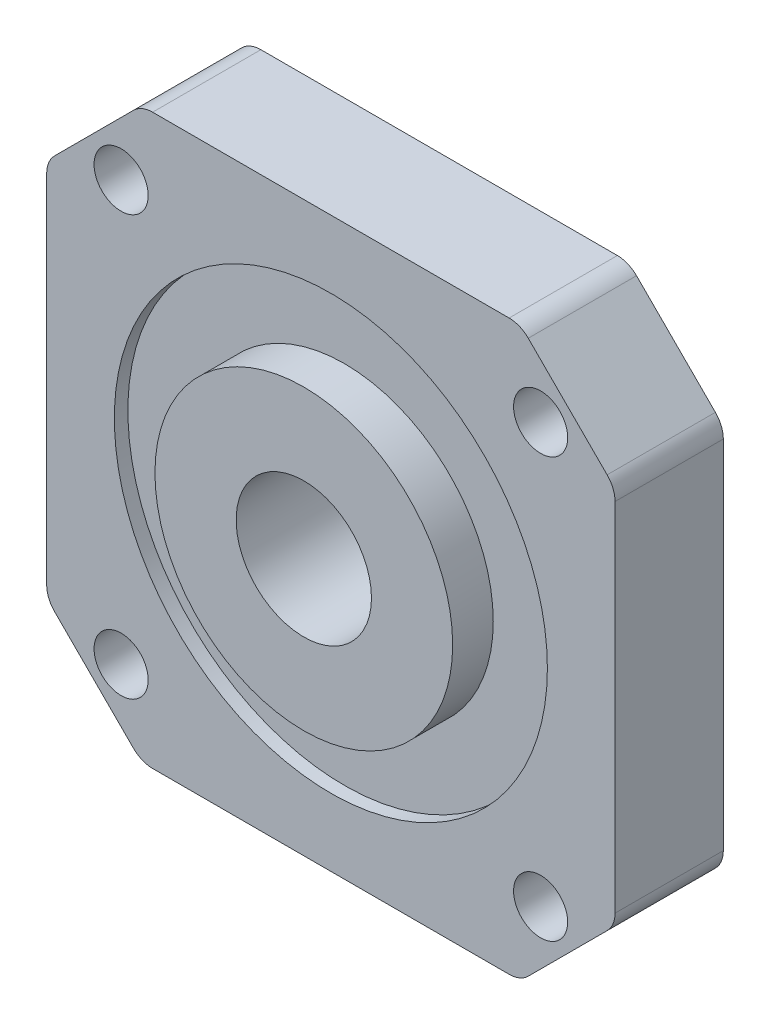
from build123d import *

# Parameters (mm, degrees)
SKETCH1_W                               = 42
SKETCH1_H                               = 42
BOSS_EXTRUDE1_DEPTH                     = 4
CUT_EXTRUDE1_REACH                      = 32.757
SKETCH3_R                               = 16
SKETCH3_R_2                             = 11
CUT_EXTRUDE2_DEPTH                      = 1
BOSS_EXTRUDE2_START                     = 2
SKETCH4_R                               = 11
BOSS_EXTRUDE2_DEPTH                     = 2
CUT_EXTRUDE3_REACH                      = 33.337
SKETCH5_R                               = 5
CBORE_FOR_M5_HEX_HEAD_BOLT2_D           = 3
CBORE_FOR_M5_HEX_HEAD_BOLT2_DEPTH       = 10
CBORE_FOR_M5_HEX_HEAD_BOLT2_CBORE_D     = 4
CBORE_FOR_M5_HEX_HEAD_BOLT2_CBORE_DEPTH = 3
CBORE_FOR_M5_HEX_HEAD_BOLT2_TIP         = 0.901290929
SHELL1_START                            = -4
SHELL1_OUTLINE_R                        = 8
SHELL1_DEPTH                            = 4
SHELL1_2_DEPTH                          = 2
SHELL1_3_DEPTH                          = 1
FILLET1_R                               = 2


# Read off the part's stored shape, not the designer's step: Shell1
with BuildPart() as part:
    # Sketch1 → Boss-Extrude1 (new, symmetric)
    with BuildSketch(Plane.XY):
        Rectangle(SKETCH1_W, SKETCH1_H)
    extrude(amount=BOSS_EXTRUDE1_DEPTH, both=True)

    # Sketch2 → Cut-Extrude1 (cut, up to next)
    with BuildSketch(Plane.XY.offset(4), mode=Mode.PRIVATE) as cut_extrude1_sk1:
        Polygon((-21, 21), (-21, 14), (-14, 21), align=None)
    cut_extrude1_tool1 = extrude(cut_extrude1_sk1.sketch, amount=-CUT_EXTRUDE1_REACH, mode=Mode.PRIVATE) & part.part
    # Sketch2 → Cut-Extrude1 (cut, up to next)
    with BuildSketch(Plane.XY.offset(4), mode=Mode.PRIVATE) as cut_extrude1_sk2:
        Polygon((21, 14), (14, 21), (21, 21), align=None)
    cut_extrude1_tool2 = extrude(cut_extrude1_sk2.sketch, amount=-CUT_EXTRUDE1_REACH, mode=Mode.PRIVATE) & part.part
    # Sketch2 → Cut-Extrude1 (cut, up to next)
    with BuildSketch(Plane.XY.offset(4), mode=Mode.PRIVATE) as cut_extrude1_sk3:
        Polygon((21, -21), (21, -14), (14, -21), align=None)
    cut_extrude1_tool3 = extrude(cut_extrude1_sk3.sketch, amount=-CUT_EXTRUDE1_REACH, mode=Mode.PRIVATE) & part.part
    # Sketch2 → Cut-Extrude1 (cut, up to next)
    with BuildSketch(Plane.XY.offset(4), mode=Mode.PRIVATE) as cut_extrude1_sk4:
        Polygon((-21, -14), (-14, -21), (-21, -21), align=None)
    cut_extrude1_tool4 = extrude(cut_extrude1_sk4.sketch, amount=-CUT_EXTRUDE1_REACH, mode=Mode.PRIVATE) & part.part
    add(cut_extrude1_tool1.solids().sort_by_distance((-18.666667, 18.666667, 4))[0], mode=Mode.SUBTRACT)
    add(cut_extrude1_tool2.solids().sort_by_distance((18.666667, 18.666667, 4))[0], mode=Mode.SUBTRACT)
    add(cut_extrude1_tool3.solids().sort_by_distance((18.666667, -18.666667, 4))[0], mode=Mode.SUBTRACT)
    add(cut_extrude1_tool4.solids().sort_by_distance((-18.666667, -18.666667, 4))[0], mode=Mode.SUBTRACT)

    # Sketch3 → Cut-Extrude2 (cut)
    with BuildSketch(Plane.XY.offset(4)):
        Circle(SKETCH3_R)
        Circle(SKETCH3_R_2, mode=Mode.SUBTRACT)
    extrude(amount=-CUT_EXTRUDE2_DEPTH, mode=Mode.SUBTRACT)

    # Sketch4 → Boss-Extrude2 (add)
    with BuildSketch(Plane.XY.offset(4).offset(BOSS_EXTRUDE2_START)):
        Circle(SKETCH4_R)
    extrude(amount=-BOSS_EXTRUDE2_DEPTH)

    # Sketch5 → Cut-Extrude3 (cut, up to next)
    with BuildSketch(Plane.XY.offset(6), mode=Mode.PRIVATE) as cut_extrude3_sk1:
        Circle(SKETCH5_R)
    cut_extrude3_tool1 = extrude(cut_extrude3_sk1.sketch, amount=-CUT_EXTRUDE3_REACH, mode=Mode.PRIVATE) & part.part
    add(cut_extrude3_tool1.solids().sort_by_distance((0, 0, 6))[0], mode=Mode.SUBTRACT)

    # CBORE for M5 Hex Head Bolt2
    with Locations(Plane.XY.offset(4)):
        with Locations((-15.5, 15.5), (15.5, 15.5), (15.5, -15.5), (-15.5, -15.5)):
            CounterBoreHole(CBORE_FOR_M5_HEX_HEAD_BOLT2_D / 2, CBORE_FOR_M5_HEX_HEAD_BOLT2_CBORE_D / 2, CBORE_FOR_M5_HEX_HEAD_BOLT2_CBORE_DEPTH, depth=CBORE_FOR_M5_HEX_HEAD_BOLT2_DEPTH)
            with Locations((0, 0, -(CBORE_FOR_M5_HEX_HEAD_BOLT2_DEPTH + CBORE_FOR_M5_HEX_HEAD_BOLT2_TIP / 2))):  # 118° drill point
                Cone(0, CBORE_FOR_M5_HEX_HEAD_BOLT2_D / 2, CBORE_FOR_M5_HEX_HEAD_BOLT2_TIP, mode=Mode.SUBTRACT)

    # Shell1 outline → Shell1 (cut)
    with BuildSketch(Plane.XY.offset(SHELL1_START)):
        with BuildLine():
            ThreePointArc((-18, -11.169872981), (-11.964466094, -11.964466094), (-11.169872981, -18))
            Line((-11.169872981, -18), (11.169872981, -18))
            ThreePointArc((11.169872981, -18), (11.964466094, -11.964466094), (18, -11.169872981))
            Line((18, -11.169872981), (18, 11.169872981))
            ThreePointArc((18, 11.169872981), (11.964466094, 11.964466094), (11.169872981, 18))
            Line((11.169872981, 18), (-11.169872981, 18))
            ThreePointArc((-11.169872981, 18), (-11.964466094, 11.964466094), (-18, 11.169872981))
            Line((-18, 11.169872981), (-18, -11.169872981))
        make_face()
        Circle(SHELL1_OUTLINE_R, mode=Mode.SUBTRACT)
    extrude(amount=SHELL1_DEPTH, mode=Mode.SUBTRACT)

    # Shell1 2 outline → Shell1 2 (cut)
    with BuildSketch(Plane.XY.offset(SHELL1_START)):
        with BuildLine():
            Line((-18, -11.169872981), (-18, -11.758342613))
            ThreePointArc((-18, -11.758342613), (-12.318019485, -12.318019485), (-11.758342613, -18))
            Line((-11.758342613, -18), (-11.169872981, -18))
            ThreePointArc((-11.169872981, -18), (-11.964466094, -11.964466094), (-18, -11.169872981))
        make_face()
        with BuildLine():
            Line((-18, 11.758342613), (-18, 11.169872981))
            ThreePointArc((-18, 11.169872981), (-11.964466094, 11.964466094), (-11.169872981, 18))
            Line((-11.169872981, 18), (-11.758342613, 18))
            ThreePointArc((-11.758342613, 18), (-12.318019485, 12.318019485), (-18, 11.758342613))
        make_face()
        with BuildLine():
            ThreePointArc((18, -11.169872981), (11.964466094, -11.964466094), (11.169872981, -18))
            Line((11.169872981, -18), (11.758342613, -18))
            ThreePointArc((11.758342613, -18), (12.318019485, -12.318019485), (18, -11.758342613))
            Line((18, -11.758342613), (18, -11.169872981))
        make_face()
        with BuildLine():
            Line((11.758342613, 18), (11.169872981, 18))
            ThreePointArc((11.169872981, 18), (11.964466094, 11.964466094), (18, 11.169872981))
            Line((18, 11.169872981), (18, 11.758342613))
            ThreePointArc((18, 11.758342613), (12.318019485, 12.318019485), (11.758342613, 18))
        make_face()
    extrude(amount=SHELL1_2_DEPTH, mode=Mode.SUBTRACT)

    # Shell1 3 outline → Shell1 3 (cut)
    with BuildSketch(Plane.XY):
        with BuildLine():
            Line((-18, -6.08276253), (-18, -11.169872981))
            ThreePointArc((-18, -11.169872981), (-16.951868237, -10.715433288), (-15.827943399, -10.510766278))
            ThreePointArc((-15.827943399, -10.510766278), (-17.058260256, -8.367541876), (-18, -6.08276253))
        make_face()
        with BuildLine():
            ThreePointArc((-10.510766278, -15.827943399), (-10.715433288, -16.951868237), (-11.169872981, -18))
            Line((-11.169872981, -18), (-6.08276253, -18))
            ThreePointArc((-6.08276253, -18), (-8.367541876, -17.058260256), (-10.510766278, -15.827943399))
        make_face()
        with BuildLine():
            Line((-18, 11.169872981), (-18, 6.08276253))
            ThreePointArc((-18, 6.08276253), (-17.058260256, 8.367541876), (-15.827943399, 10.510766279))
            ThreePointArc((-15.827943399, 10.510766279), (-16.951868237, 10.715433288), (-18, 11.169872981))
        make_face()
        with BuildLine():
            ThreePointArc((10.510766279, -15.827943399), (8.367541876, -17.058260256), (6.08276253, -18))
            Line((6.08276253, -18), (11.169872981, -18))
            ThreePointArc((11.169872981, -18), (10.715433288, -16.951868237), (10.510766279, -15.827943399))
        make_face()
        with BuildLine():
            ThreePointArc((-11.169872981, 18), (-10.715433288, 16.951868237), (-10.510766278, 15.827943399))
            ThreePointArc((-10.510766278, 15.827943399), (-8.367541876, 17.058260256), (-6.08276253, 18))
            Line((-6.08276253, 18), (-11.169872981, 18))
        make_face()
        with BuildLine():
            ThreePointArc((18, -6.08276253), (17.058260256, -8.367541876), (15.827943399, -10.510766279))
            ThreePointArc((15.827943399, -10.510766279), (16.951868237, -10.715433288), (18, -11.169872981))
            Line((18, -11.169872981), (18, -6.08276253))
        make_face()
        with BuildLine():
            Line((11.169872981, 18), (6.08276253, 18))
            ThreePointArc((6.08276253, 18), (8.367541876, 17.058260256), (10.510766279, 15.827943399))
            ThreePointArc((10.510766279, 15.827943399), (10.715433288, 16.951868237), (11.169872981, 18))
        make_face()
        with BuildLine():
            ThreePointArc((15.827943399, 10.510766279), (17.058260256, 8.367541876), (18, 6.08276253))
            Line((18, 6.08276253), (18, 11.169872981))
            ThreePointArc((18, 11.169872981), (16.951868237, 10.715433288), (15.827943399, 10.510766279))
        make_face()
    extrude(amount=SHELL1_3_DEPTH, mode=Mode.SUBTRACT)

    # Fillet1
    fillet1_edges = [part.edges().sort_by_distance(p)[0] for p in [
        (-21, -14, 0),
        (-14, -21, 0),
        (14, -21, 0),
        (21, -14, 0),
        (21, 14, 0),
        (14, 21, 0),
        (-14, 21, 0),
        (-21, 14, 0),
    ]]
    fillet(fillet1_edges, radius=FILLET1_R)


solid = part.part
